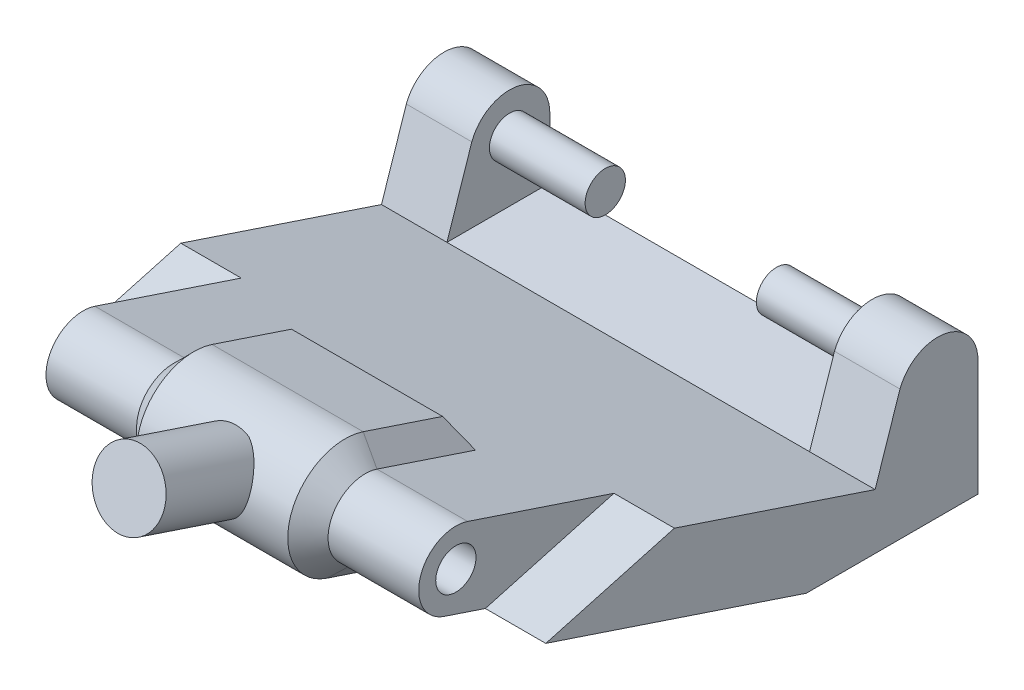
from build123d import *

# Parameters (mm, degrees)
BOSS_EXTRUDE1_DEPTH = 13
CHAMFER1_SIZE       = 39
CHAMFER1_SIZE_2     = 13
CUT_EXTRUDE1_DEPTH  = 49
CUT_EXTRUDE2_DEPTH  = 49
CUT_EXTRUDE3_DEPTH  = 36
SKETCH5_R           = 2
BOSS_EXTRUDE2_DEPTH = 9.5
BOSS_EXTRUDE3_START = 9.5
SKETCH7_R           = 2
BOSS_EXTRUDE3_DEPTH = 9.5
SKETCH8_W           = 49
SKETCH8_H           = 7.378647874
BOSS_EXTRUDE4_DEPTH = 40
CUT_EXTRUDE4_DEPTH  = 49
CUT_EXTRUDE5_DEPTH  = 6
CUT_EXTRUDE6_START  = -6
CUT_EXTRUDE6_DEPTH  = 6
SKETCH12_R          = 2
CUT_EXTRUDE7_DEPTH  = 37
BOSS_EXTRUDE5_DEPTH = 15
CHAMFER2_SIZE       = 2
BOSS_EXTRUDE6_START = -1
SKETCH14_R          = 3.5
BOSS_EXTRUDE6_DEPTH = 10
SKETCH16_W          = 17.046740202
SKETCH16_H          = 1.5
CUT_EXTRUDE8_DEPTH  = 49


# Some blends are built 0.0001 mm under size
with BuildPart() as part:
    # Sketch1 → Boss-Extrude1 (new body)
    with BuildSketch(Plane.XY):
        Polygon((0, -15), (24.5, -15), (24.5, 24), (-24.5, 24), (-24.5, -15), align=None)
    extrude(amount=BOSS_EXTRUDE1_DEPTH)

    # Chamfer1
    # the kernel refuses this chamfer: 39, 13 mm, written as the material it takes off along each edge
    with BuildSketch(Plane(origin=(125.707379416, 24, 13), x_dir=(0, -0.9999257509361695, 0.012185754582199166), z_dir=(-1, 0, 0))) as chamfer1_piece_1:
        Polygon((CHAMFER1_SIZE * 0.999925750936, -CHAMFER1_SIZE * 0.0121857545822), (-CHAMFER1_SIZE_2 * 0.0121857545822, -CHAMFER1_SIZE_2 * 0.999925750936), (0, 0), align=None)
    extrude(amount=251.414758831, mode=Mode.SUBTRACT)

    # Sketch2 → Cut-Extrude1 (cut)
    with BuildSketch(Plane(origin=(24.5, 0, 0), x_dir=(0, 0, -1), z_dir=(1, 0, 0))):
        Polygon((0, 2), (-7.333333333, 2), (0, 24), align=None)
    extrude(amount=-CUT_EXTRUDE1_DEPTH, mode=Mode.SUBTRACT)

    # Sketch3 → Cut-Extrude2 (cut)
    with BuildSketch(Plane(origin=(24.5, 0, 0), x_dir=(0, 0, -1), z_dir=(1, 0, 0))):
        with BuildLine():
            Line((-7.333333333, 2), (-13, -15))
            Line((-13, -15), (-12.546740202, -15))
            Line((-12.546740202, -15), (-7.744650675, -0.593731419))
            ThreePointArc((-7.744650675, -0.593731419), (-6.277600237, 1.28824226), (-4, 2))
            Line((-4, 2), (-7.333333333, 2))
        make_face()
        with BuildLine():
            Line((0, 2), (-4, 2))
            ThreePointArc((-4, 2), (-1.171572875, 0.828427125), (0, -2))
            Line((0, -2), (0, 2))
        make_face()
    extrude(amount=-CUT_EXTRUDE2_DEPTH, mode=Mode.SUBTRACT)

    # Sketch4 → Cut-Extrude3 (cut)
    with BuildSketch(Plane(origin=(18, 0, 0), x_dir=(0, 0, -1), z_dir=(1, 0, 0))):
        with BuildLine():
            Line((0, -8), (-10.213406869, -8))
            Line((-10.213406869, -8), (-7.744650675, -0.593731419))
            ThreePointArc((-7.744650675, -0.593731419), (-3.285368172, 1.935644973), (0, -2))
            Line((0, -2), (0, -8))
        make_face()
    extrude(amount=-CUT_EXTRUDE3_DEPTH, mode=Mode.SUBTRACT)

    # Sketch5 → Boss-Extrude2 (add)
    with BuildSketch(Plane.ZY.offset(-18)):
        with Locations(Location((4, -2, 0), (0, 0, 180))):
            Circle(SKETCH5_R)
    extrude(amount=BOSS_EXTRUDE2_DEPTH)

    # Sketch7 → Boss-Extrude3 (add)
    with BuildSketch(Plane(origin=(-18, 0, 0), x_dir=(0, 0, -1), z_dir=(1, 0, 0)).offset(BOSS_EXTRUDE3_START)):
        with Locations((-4, -2)):
            Circle(SKETCH7_R)
    extrude(amount=-BOSS_EXTRUDE3_DEPTH)

    # Sketch8 → Boss-Extrude4 (add)
    with BuildSketch(Plane(origin=(0, 2.264022061, 6.792066182), x_dir=(1, 0, 0), z_dir=(0, 0.31622776601683816, 0.9486832980505138))):
        with Locations((0, -14.508553159)):
            Rectangle(SKETCH8_W, SKETCH8_H)
    extrude(amount=BOSS_EXTRUDE4_DEPTH)

    # Sketch9 → Cut-Extrude4 (cut)
    with BuildSketch(Plane(origin=(24.5, 0, 0), x_dir=(0, 0, -1), z_dir=(1, 0, 0))):
        with BuildLine():
            ThreePointArc((-46.994072124, -3.517556026), (-49.127237075, -1.667471905), (-49.327405497, 1.149110522))
            Line((-49.327405497, 1.149110522), (-50.494072124, -2.350889359))
            Line((-50.494072124, -2.350889359), (-46.994072124, -3.517556026))
        make_face()
        with BuildLine():
            ThreePointArc((-49.327405497, 1.149110522), (-47.477321336, 3.282275592), (-44.660738791, 3.482443974))
            Line((-44.660738791, 3.482443974), (-48.160738791, 4.649110641))
            Line((-48.160738791, 4.649110641), (-49.327405497, 1.149110522))
        make_face()
    extrude(amount=-CUT_EXTRUDE4_DEPTH, mode=Mode.SUBTRACT)

    # Sketch10 → Cut-Extrude5 (cut)
    with BuildSketch(Plane(origin=(24.5, 0, 0), x_dir=(0, 0, -1), z_dir=(1, 0, 0))):
        with BuildLine():
            Line((-42.90460574, -4.880711487), (-30.135756128, -1.359216914))
            Line((-30.135756128, -1.359216914), (-44.660738791, 3.482443974))
            ThreePointArc((-44.660738791, 3.482443974), (-49.327405457, 1.149110641), (-46.994072124, -3.517556026))
            Line((-46.994072124, -3.517556026), (-42.90460574, -4.880711487))
        make_face()
    extrude(amount=-CUT_EXTRUDE5_DEPTH, mode=Mode.SUBTRACT)

    # Sketch11 → Cut-Extrude6 (cut)
    with BuildSketch(Plane.ZY.offset(24.5).offset(CUT_EXTRUDE6_START)):
        with BuildLine():
            Line((30.135756128, -1.359216914), (42.90460574, -4.880711487))
            Line((42.90460574, -4.880711487), (46.994072124, -3.517556026))
            ThreePointArc((46.994072124, -3.517556026), (49.327405457, 1.149110641), (44.660738791, 3.482443974))
            Line((44.660738791, 3.482443974), (30.135756128, -1.359216914))
        make_face()
    extrude(amount=CUT_EXTRUDE6_DEPTH, mode=Mode.SUBTRACT)

    # Sketch12 → Cut-Extrude7 (cut)
    with BuildSketch(Plane.ZY.offset(18.5)):
        with Locations((45.827405457, -0.017556026)):
            Circle(SKETCH12_R)
    extrude(amount=-CUT_EXTRUDE7_DEPTH, mode=Mode.SUBTRACT)

    # Sketch13 → Boss-Extrude5 (add)
    with BuildSketch(Plane(origin=(7.5, 0, 0), x_dir=(0, 0, -1), z_dir=(1, 0, 0))):
        with BuildLine():
            Line((-36.144083682, 2.751744045), (-44.028283259, 5.37981057))
            ThreePointArc((-44.028283259, 5.37981057), (-51.224772053, 1.781566173), (-47.626527656, -5.414922622))
            Line((-47.626527656, -5.414922622), (-43.537061272, -6.778078084))
            Line((-43.537061272, -6.778078084), (-39.742328079, -8.042989148))
            Line((-39.742328079, -8.042989148), (-39.109872547, -6.145622552))
            Line((-39.109872547, -6.145622552), (-42.90460574, -4.880711487))
            Line((-42.90460574, -4.880711487), (-46.994072124, -3.517556026))
            ThreePointArc((-46.994072124, -3.517556026), (-49.327405457, 1.149110641), (-44.660738791, 3.482443974))
            Line((-44.660738791, 3.482443974), (-36.776539214, 0.854377448))
            Line((-36.776539214, 0.854377448), (-36.144083682, 2.751744045))
        make_face()
    extrude(amount=-BOSS_EXTRUDE5_DEPTH)

    # Chamfer2
    chamfer2_edges = [part.edges().sort_by_distance(p)[0] for p in [
        (0, 0.854377448, 36.776539214),
        (-7.5, 2.168410711, 40.718639002),
        (7.5, 2.168410711, 40.718639002),
        (-7.5, 1.149110641, 49.327405457),
        (7.5, 1.149110641, 49.327405457),
        (-7.5, -4.831589289, 43.051972336),
        (0, -6.145622552, 39.109872547),
        (7.5, -4.831589289, 43.051972336),
    ]]
    chamfer(chamfer2_edges, length=CHAMFER2_SIZE - 0.0001)  # a hair under: the kernel refuses the full size

    # Sketch14 → Boss-Extrude6 (add)
    with BuildSketch(Plane(origin=(-7.5, 1.781566173, 51.224772053), x_dir=(1, 0, 0), z_dir=(0, 0.31622776601683844, 0.9486832980505138)).offset(BOSS_EXTRUDE6_START)):
        with Locations(Location((7.5, 0, 0), (0, 0, 66.99262336))):
            Circle(SKETCH14_R)
    extrude(amount=BOSS_EXTRUDE6_DEPTH)

    # Sketch16 → Cut-Extrude8 (cut)
    with BuildSketch(Plane(origin=(24.5, 0, 0), x_dir=(0, 0, -1), z_dir=(1, 0, 0))):
        with Locations((-8.523370101, -14.25)):
            Rectangle(SKETCH16_W, SKETCH16_H)
    extrude(amount=-CUT_EXTRUDE8_DEPTH, mode=Mode.SUBTRACT)


solid = part.part
